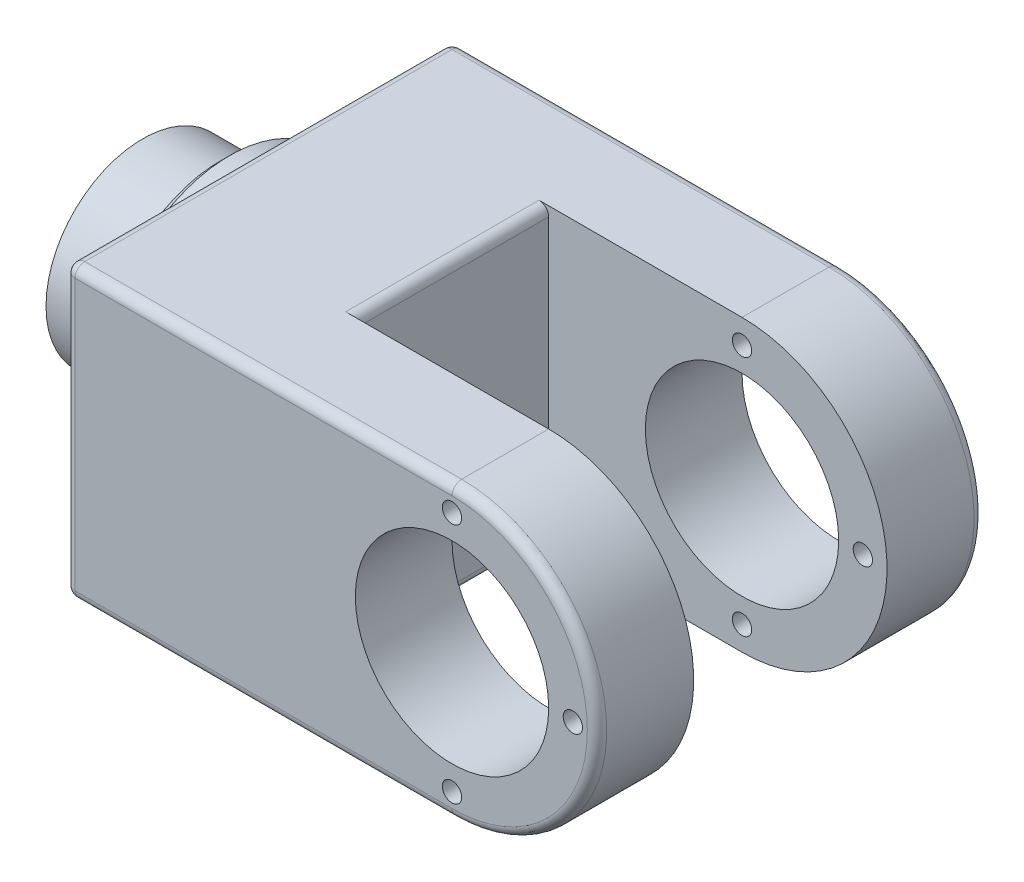
from build123d import *

# Parameters (mm, degrees)
BOSS_EXTRUDE1_DEPTH = 100
CUT_EXTRUDE1_DEPTH  = 50
SKETCH3_R           = 65
BOSS_EXTRUDE2_DEPTH = 20
SKETCH4_R           = 50
BOSS_EXTRUDE3_DEPTH = 40
CHAMFER1_SIZE       = 5
SKETCH5_R           = 5
CUT_EXTRUDE2_DEPTH  = 337.489227168
FILLET1_R           = 5
SKETCH6_R           = 50
CUT_EXTRUDE3_DEPTH  = 337.489227168


with BuildPart() as part:
    # Sketch1 → Boss-Extrude1 (new, symmetric)
    with BuildSketch(Plane.XY):
        with BuildLine():
            Line((0, 75), (-200, 75))
            Line((-200, 75), (-200, -75))
            Line((-200, -75), (0, -75))
            ThreePointArc((0, -75), (75, 0), (0, 75))
        make_face()
    extrude(amount=BOSS_EXTRUDE1_DEPTH, both=True)

    # Sketch2 → Cut-Extrude1 (cut, symmetric)
    with BuildSketch(Plane.XY):
        with BuildLine():
            Line((0, 75), (-100, 75))
            Line((-100, 75), (-100, -75))
            Line((-100, -75), (0, -75))
            ThreePointArc((0, -75), (75, 0), (0, 75))
        make_face()
    extrude(amount=CUT_EXTRUDE1_DEPTH, both=True, mode=Mode.SUBTRACT)

    # Sketch3 → Boss-Extrude2 (add)
    with BuildSketch(Plane.ZY.offset(200)):
        with Locations(Location((0, 0, 0), (0, 0, 180))):
            Circle(SKETCH3_R)
    extrude(amount=BOSS_EXTRUDE2_DEPTH)

    # Sketch4 → Boss-Extrude3 (add)
    with BuildSketch(Plane.ZY.offset(220)):
        Circle(SKETCH4_R)
    extrude(amount=BOSS_EXTRUDE3_DEPTH)

    # Chamfer1
    chamfer1_edges = [part.edges().sort_by_distance(p)[0] for p in [
        (-220, 0, 65),
    ]]
    chamfer(chamfer1_edges, length=CHAMFER1_SIZE)

    # Sketch5 → Cut-Extrude2 (cut, through all)
    with BuildSketch(Plane.XY.offset(100)):
        with Locations((0, 62.5)):
            Circle(SKETCH5_R)
        with Locations((62.5, 0)):
            Circle(SKETCH5_R)
        with Locations((0, -62.5)):
            Circle(SKETCH5_R)
    extrude(amount=-CUT_EXTRUDE2_DEPTH, mode=Mode.SUBTRACT)

    # Fillet1
    fillet1_edges = [part.edges().sort_by_distance(p)[0] for p in [
        (-200, 0, 100),
        (-100, -75, 100),
        (-100, -75, 0),
        (-100, 75, 0),
        (-200, 0, 65),
        (-220, 0, -50),
        (75, 0, 100),
        (-100, -75, -100),
        (-200, 0, -100),
        (-100, 75, -100),
        (75, 0, -100),
        (-100, 75, 100),
        (-200, -75, 0),
        (-200, 75, 0),
    ]]
    fillet(fillet1_edges, radius=FILLET1_R - 0.0001)  # a hair under: the kernel refuses the full size

    # Sketch6 → Cut-Extrude3 (cut, through all)
    with BuildSketch(Plane.XY.offset(100)):
        Circle(SKETCH6_R)
    extrude(amount=-CUT_EXTRUDE3_DEPTH, mode=Mode.SUBTRACT)


solid = part.part
